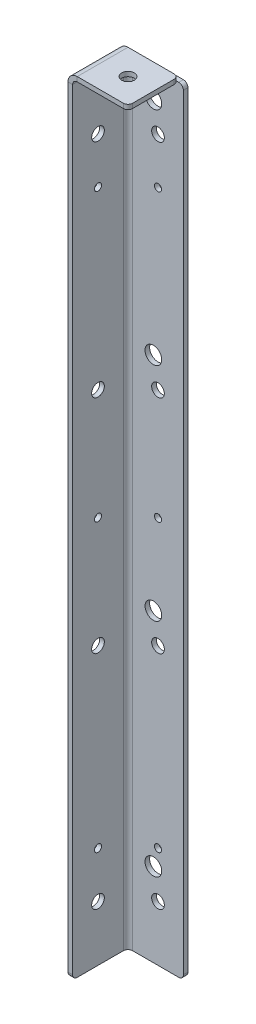
from build123d import *

# Parameters (mm, degrees)
BASE_FLANGE1_DEPTH               = 266.7
F_10_0_1935_DIAMETER_HOLE1_D     = 4.9149
F_29_64_0_45313_DIAMETER_HOLE1_D = 11.509502
F_11_32_0_34375_DIAMETER_HOLE1_D = 8.73125
EDGE_FLANGE1_DEPTH               = 34.925
F_11_32_0_34375_DIAMETER_HOLE2_D = 8.73125
F_11_32_0_34375_DIAMETER_HOLE6_D = 8.73125
FILLET1_R                        = 3.175
F_10_0_1935_DIAMETER_HOLE2_D     = 4.9149


# Sheet-metal steps are written as plain solids
with BuildPart() as part:
    # Sketch1 → Base-Flange1 (new, symmetric)
    with BuildSketch(Plane(origin=(0, 0, 0), x_dir=(1, 0, 0), z_dir=(0, 1, 0))):
        with BuildLine():
            Line((38.1, 0), (3.175, 0))
            ThreePointArc((3.175, 0), (0.92993597, -0.92993597), (0, -3.175))
            Line((0, -3.175), (0, -38.1))
            Line((0, -38.1), (-3.175, -38.1))
            Line((-3.175, -38.1), (-3.175, -3.175))
            ThreePointArc((-3.175, -3.175), (-1.315128061, 1.315128061), (3.175, 3.175))
            Line((3.175, 3.175), (38.1, 3.175))
            Line((38.1, 3.175), (38.1, 0))
        make_face()
    extrude(amount=BASE_FLANGE1_DEPTH, both=True)

    # #10 (0.1935) Diameter Hole1 (through all)
    with Locations(Plane.XY):
        with Locations((20.6375, -196.85), (20.6375, 0), (20.6375, 196.85)):
            Hole(F_10_0_1935_DIAMETER_HOLE1_D / 2)

    # 29/64 (0.45313) Diameter Hole1 (through all)
    with Locations(Plane.XY):
        with Locations((17.4625, 247.904), (17.4625, 95.504), (17.4625, -56.896), (17.4625, -209.296)):
            Hole(F_29_64_0_45313_DIAMETER_HOLE1_D / 2)

    # 11/32 (0.34375) Diameter Hole1 (through all)
    with Locations(Plane.XY):
        with Locations((20.6375, 228.6), (20.6375, 76.2), (20.6375, -76.2), (20.6375, -228.6)):
            Hole(F_11_32_0_34375_DIAMETER_HOLE1_D / 2)

    # Edge-Flange1 section (across the edge) → Edge-Flange1 (add)
    with BuildSketch(Plane(origin=(0, 273.304, 3.175), x_dir=(0, -1, 0), z_dir=(0, 0, 1))):
        with BuildLine():
            Line((0, 3.175), (0, 38.1))
            Line((0, 38.1), (3.175, 38.1))
            Line((3.175, 38.1), (3.175, 3.175))
            ThreePointArc((3.175, 3.175), (4.10493597, 0.92993597), (6.35, 0))
            Line((6.35, 0), (6.604, 0))
            Line((6.604, 0), (6.604, -3.175))
            Line((6.604, -3.175), (6.35, -3.175))
            ThreePointArc((6.35, -3.175), (1.859871939, -1.315128061), (0, 3.175))
        make_face()
    extrude(amount=EDGE_FLANGE1_DEPTH)

    # 11/32 (0.34375) Diameter Hole2 (through all)
    with Locations(Plane(origin=(0, 0, 0), x_dir=(0, 0, -1), z_dir=(1, 0, 0))):
        with Locations((-20.6375, 228.854), (-20.6375, 76.369333333), (-20.6375, -76.115333333), (-20.6375, -228.6)):
            Hole(F_11_32_0_34375_DIAMETER_HOLE2_D / 2)

    # 11/32 (0.34375) Diameter Hole6 (through all)
    with Locations(Plane(origin=(0, 273.304, 0), x_dir=(1, 0, 0), z_dir=(0, 1, 0))):
        with Locations((20.6375, -20.6375)):
            Hole(F_11_32_0_34375_DIAMETER_HOLE6_D / 2)

    # Fillet1
    fillet1_edges = [part.edges().sort_by_distance(p)[0] for p in [
        (38.1, 271.7165, 3.175),
        (38.1, 271.7165, 38.1),
        (38.1, 266.7, -1.5875),
        (38.1, -266.7, -1.5875),
        (-1.5875, -266.7, 38.1),
    ]]
    fillet(fillet1_edges, radius=FILLET1_R)

    # #10 (0.1935) Diameter Hole2 (through all)
    with Locations(Plane(origin=(0, 0, 0), x_dir=(0, 0, -1), z_dir=(1, 0, 0))):
        with Locations((-20.6375, 197.104), (-20.6375, -196.85), (-20.6375, 0.127)):
            Hole(F_10_0_1935_DIAMETER_HOLE2_D / 2)


solid = part.part
